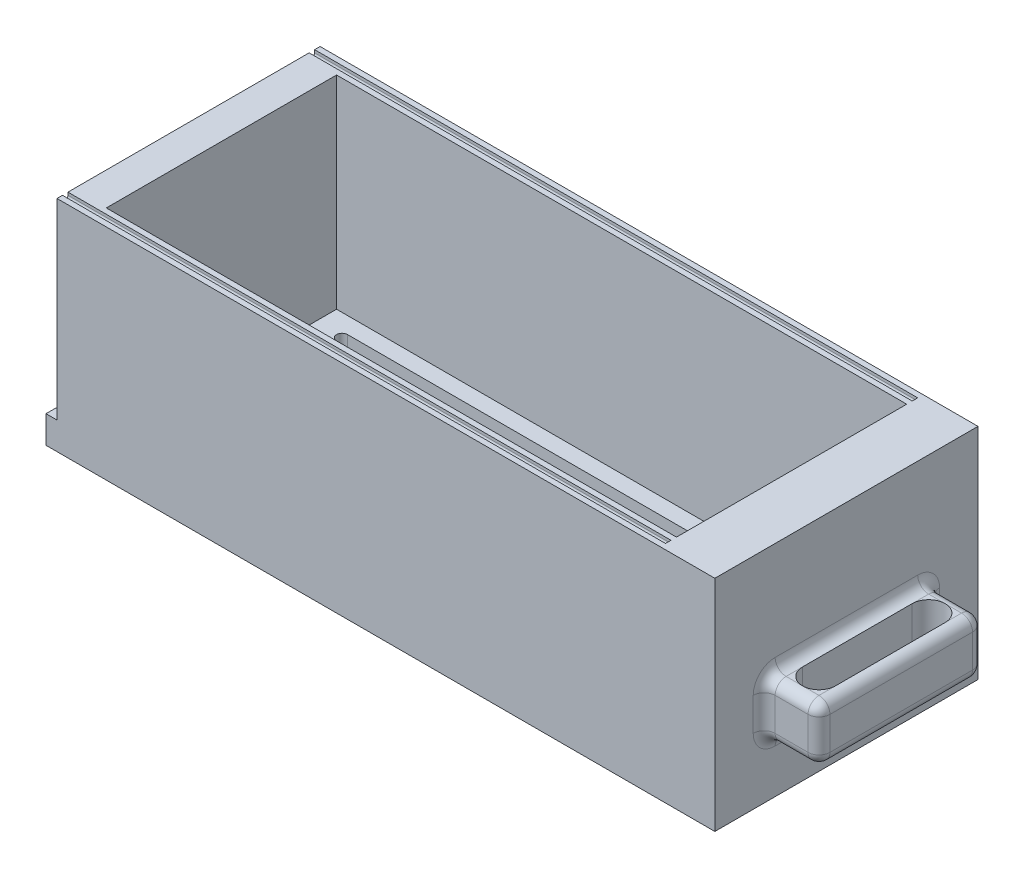
from build123d import *

# Parameters (mm, degrees)
SKETCH1_W           = 120
SKETCH1_H           = 48
BOSS_EXTRUDE1_DEPTH = 40
SKETCH3_W           = 104
SKETCH3_H           = 42
CUT_EXTRUDE1_DEPTH  = 37
CUT_EXTRUDE2_DEPTH  = 37
CUT_EXTRUDE4_DEPTH  = 110
SKETCH10_W          = 48
SKETCH10_H          = 5
BOSS_EXTRUDE3_DEPTH = 2
SKETCH11_W          = 30
SKETCH11_H          = 10
BOSS_EXTRUDE4_DEPTH = 10
CUT_EXTRUDE6_DEPTH  = 8
FILLET1_R           = 2
CUT_EXTRUDE5_DEPTH  = 110


with BuildPart() as part:
    # Sketch1 → Boss-Extrude1 (new body)
    with BuildSketch(Plane(origin=(0, 0, 0), x_dir=(1, 0, 0), z_dir=(0, 1, 0))):
        with Locations((60, 24)):
            Rectangle(SKETCH1_W, SKETCH1_H)
    extrude(amount=BOSS_EXTRUDE1_DEPTH)

    # Sketch3 → Cut-Extrude1 (cut)
    with BuildSketch(Plane(origin=(0, 40, 0), x_dir=(1, 0, 0), z_dir=(0, 1, 0))):
        with Locations((58, 24)):
            Rectangle(SKETCH3_W, SKETCH3_H)
    extrude(amount=-CUT_EXTRUDE1_DEPTH, mode=Mode.SUBTRACT)

    # Sketch5 → Cut-Extrude2 (cut)
    with BuildSketch(Plane(origin=(0, 3, 0), x_dir=(1, 0, 0), z_dir=(0, 1, 0))):
        with BuildLine():
            Line((11, 42), (105, 42))
            ThreePointArc((105, 42), (106, 41), (105, 40))
            Line((105, 40), (11, 40))
            ThreePointArc((11, 40), (10, 41), (11, 42))
        make_face()
        with BuildLine():
            Line((11, 35.1), (105, 35.1))
            ThreePointArc((105, 35.1), (106, 36.1), (105, 37.1))
            Line((105, 37.1), (11, 37.1))
            ThreePointArc((11, 37.1), (10, 36.1), (11, 35.1))
        make_face()
        with BuildLine():
            Line((11, 30.2), (105, 30.2))
            ThreePointArc((105, 30.2), (106, 31.2), (105, 32.2))
            Line((105, 32.2), (11, 32.2))
            ThreePointArc((11, 32.2), (10, 31.2), (11, 30.2))
        make_face()
        with BuildLine():
            Line((11, 25.3), (105, 25.3))
            ThreePointArc((105, 25.3), (106, 26.3), (105, 27.3))
            Line((105, 27.3), (11, 27.3))
            ThreePointArc((11, 27.3), (10, 26.3), (11, 25.3))
        make_face()
        with BuildLine():
            Line((11, 20.4), (105, 20.4))
            ThreePointArc((105, 20.4), (106, 21.4), (105, 22.4))
            Line((105, 22.4), (11, 22.4))
            ThreePointArc((11, 22.4), (10, 21.4), (11, 20.4))
        make_face()
        with BuildLine():
            Line((11, 15.5), (105, 15.5))
            ThreePointArc((105, 15.5), (106, 16.5), (105, 17.5))
            Line((105, 17.5), (11, 17.5))
            ThreePointArc((11, 17.5), (10, 16.5), (11, 15.5))
        make_face()
        with BuildLine():
            Line((11, 10.6), (105, 10.6))
            ThreePointArc((105, 10.6), (106, 11.6), (105, 12.6))
            Line((105, 12.6), (11, 12.6))
            ThreePointArc((11, 12.6), (10, 11.6), (11, 10.6))
        make_face()
        with BuildLine():
            Line((11, 5.7), (105, 5.7))
            ThreePointArc((105, 5.7), (106, 6.7), (105, 7.7))
            Line((105, 7.7), (11, 7.7))
            ThreePointArc((11, 7.7), (10, 6.7), (11, 5.7))
        make_face()
    extrude(amount=-CUT_EXTRUDE2_DEPTH, mode=Mode.SUBTRACT)

    # Sketch7 → Cut-Extrude4 (cut)
    with BuildSketch(Plane.ZY):
        with BuildLine():
            Line((-2, 39.5), (-2, 40.5))
            ThreePointArc((-2, 40.5), (-1.5, 41), (-1, 40.5))
            Line((-1, 40.5), (-1, 39.5))
            ThreePointArc((-1, 39.5), (-1.5, 39), (-2, 39.5))
        make_face()
    cut_extrude4 = extrude(amount=-CUT_EXTRUDE4_DEPTH, mode=Mode.SUBTRACT)

    # Mirror1: Cut-Extrude4 across plane
    add(cut_extrude4.mirror(Plane(origin=(0, 0, -24), x_dir=(1, 0, 0), z_dir=(0, 0, -1))), mode=Mode.SUBTRACT)

    # Sketch10 → Boss-Extrude3 (add)
    with BuildSketch(Plane.ZY):
        with Locations((-24, 2.5)):
            Rectangle(SKETCH10_W, SKETCH10_H)
    extrude(amount=BOSS_EXTRUDE3_DEPTH)

    # Sketch11 → Boss-Extrude4 (add)
    with BuildSketch(Plane(origin=(120, 0, 0), x_dir=(0, 0, -1), z_dir=(1, 0, 0))):
        with Locations((24, 15)):
            Rectangle(SKETCH11_W, SKETCH11_H)
    extrude(amount=BOSS_EXTRUDE4_DEPTH)

    # Sketch12 → Cut-Extrude6 (cut)
    with BuildSketch(Plane(origin=(0, 20, 0), x_dir=(1, 0, 0), z_dir=(0, 1, 0))):
        with BuildLine():
            Line((128, 34), (128, 14))
            ThreePointArc((128, 14), (125, 11), (122, 14))
            Line((122, 14), (122, 34))
            ThreePointArc((122, 34), (125, 37), (128, 34))
        make_face()
    extrude(amount=-CUT_EXTRUDE6_DEPTH, mode=Mode.SUBTRACT)

    # Fillet1
    fillet1_edges = [part.edges().sort_by_distance(p)[0] for p in [
        (120, 15, -9),
        (125, 20, -9),
        (120, 10, -24),
        (125, 10, -9),
        (120, 15, -39),
        (125, 10, -39),
        (120, 20, -24),
        (125, 20, -39),
        (130, 15, -9),
        (130, 10, -24),
        (130, 15, -39),
        (130, 20, -24),
        (125, 12, -37),
        (128, 12, -24),
        (125, 12, -11),
        (122, 12, -24),
    ]]
    fillet(fillet1_edges, radius=FILLET1_R - 0.0001)  # a hair under: the kernel refuses the full size

    # Sketch8 → Cut-Extrude5 (cut)
    with BuildSketch(Plane.ZY.offset(2)):
        with BuildLine():
            Line((-48.5, 2), (-47.5, 2))
            ThreePointArc((-47.5, 2), (-47, 1.5), (-47.5, 1))
            Line((-47.5, 1), (-48.5, 1))
            ThreePointArc((-48.5, 1), (-49, 1.5), (-48.5, 2))
        make_face()
    extrude(amount=-CUT_EXTRUDE5_DEPTH, mode=Mode.SUBTRACT)


solid = part.part
